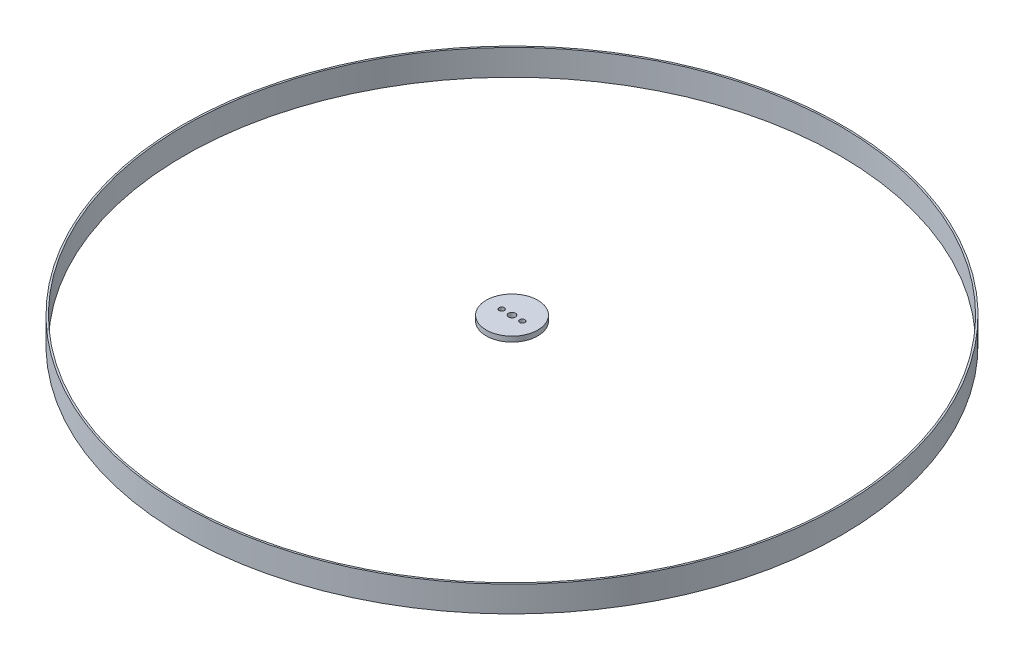
from build123d import *

# Parameters (mm, degrees)
SKETCH1_R           = 15
SKETCH1_R_2         = 1.5
SKETCH1_R_3         = 2
BOSS_EXTRUDE1_DEPTH = 3
SKETCH3_R           = 191.5
SKETCH3_R_2         = 190.5
EXTRUDE_THIN3_DEPTH = 15


with BuildPart() as part:
    # Sketch1 → Boss-Extrude1 (new body)
    with BuildSketch(Plane(origin=(0, 0, 0), x_dir=(1, 0, 0), z_dir=(0, 1, 0))):
        Circle(SKETCH1_R)
        with Locations((-6, 0)):
            Circle(SKETCH1_R_2, mode=Mode.SUBTRACT)
        Circle(SKETCH1_R_3, mode=Mode.SUBTRACT)
        with Locations((6, 0)):
            Circle(SKETCH1_R_2, mode=Mode.SUBTRACT)
    extrude(amount=BOSS_EXTRUDE1_DEPTH)


with BuildPart() as body_2:
    # Sketch3 → Extrude-Thin3 (new body)
    with BuildSketch(Plane(origin=(0, 3, 0), x_dir=(1, 0, 0), z_dir=(0, 1, 0))):
        Circle(SKETCH3_R)
        Circle(SKETCH3_R_2, mode=Mode.SUBTRACT)
    extrude(amount=-EXTRUDE_THIN3_DEPTH)


solid = Compound([part.part, body_2.part])
